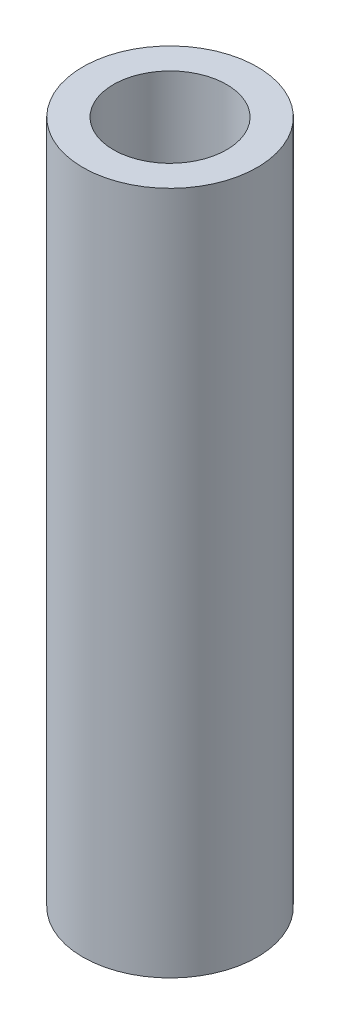
from build123d import *

# Parameters (mm, degrees)
SKETCH1_R           = 28.5
SKETCH1_R_2         = 18.5
BOSS_EXTRUDE1_DEPTH = 223.5
SKETCH2_R           = 12.53
CUT_EXTRUDE1_DEPTH  = 228.105151857


with BuildPart() as part:
    # Sketch1 → Boss-Extrude1 (new body)
    with BuildSketch(Plane(origin=(0, 0, 0), x_dir=(1, 0, 0), z_dir=(0, 1, 0))):
        Circle(SKETCH1_R)
        Circle(SKETCH1_R_2, mode=Mode.SUBTRACT)
    extrude(amount=BOSS_EXTRUDE1_DEPTH)

    # Sketch2 → Cut-Extrude1 (cut, through all)
    with BuildSketch(Plane(origin=(0, 0, 0), x_dir=(0, 0, -1), z_dir=(1, 0, 0))):
        with Locations((0, 158.8)):
            Circle(SKETCH2_R)
        with Locations((0, 98.8)):
            Circle(SKETCH2_R)
        with Locations((0, 38.8)):
            Circle(SKETCH2_R)
    extrude(amount=-CUT_EXTRUDE1_DEPTH, mode=Mode.SUBTRACT)


solid = part.part
